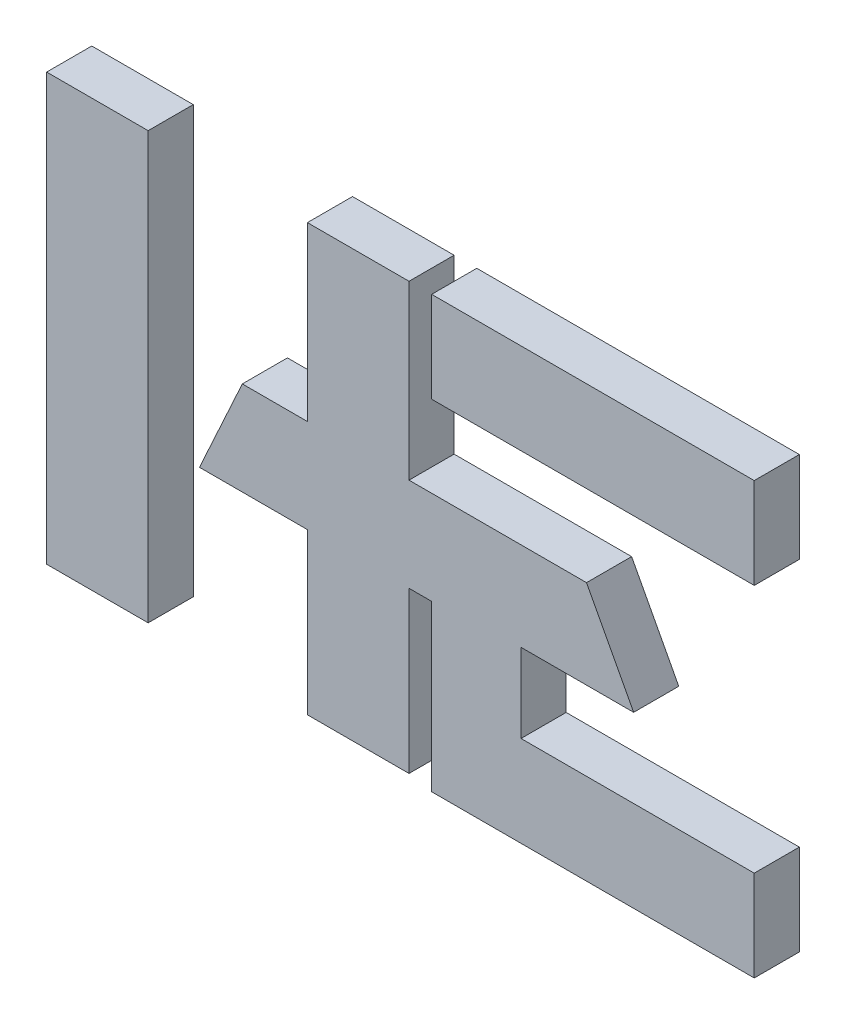
from build123d import *

# Parameters (mm, degrees)
BOSS_EXTRUDE1_DEPTH   = 2
SKETCH1_W             = 2.5
SKETCH1_H             = 10.5
BOSS_EXTRUDE1_2_DEPTH = 2
SKETCH1_W_2           = 7.945592629
SKETCH1_H_2           = 2.237026011
BOSS_EXTRUDE1_3_DEPTH = 2
SCALE2_SCALE          = 1.8
SKETCH2_W             = 50.62339921
SKETCH2_H             = 36.944200243
CUT_EXTRUDE1_DEPTH    = 1.6


with BuildPart() as part:
    # Sketch1 → Boss-Extrude1 (new body)
    with BuildSketch(Plane.XY):
        Polygon((-3.895135439, 1.034757073), (-4.950527249, -1.272027883), (-3.855272926, -1.272027883), (-2.291707931, -1.272027883), (-2.291707931, -5.222208659), (0.211078362, -5.222208659), (0.211078362, -1.272027883), (0.768928319, -1.272027883), (0.768928319, -5.333374023), (8.714520948, -5.333374023), (8.714520948, -3.096348012), (2.970174095, -3.096348012), (2.970174095, -1.151411676), (4.583415862, -1.151411676), (5.744346853, -1.151411676), (4.583415862, 1.034757073), (2.970174095, 1.034757073), (0.768928319, 1.034757073), (0.211078362, 1.034757073), (0.211078362, 5.277791341), (-2.291707931, 5.277791341), (-2.291707931, 1.034757073), align=None)
    extrude(amount=BOSS_EXTRUDE1_DEPTH)


with BuildPart() as body_2:
    # Sketch1 → Boss-Extrude1 2 (new body)
    with BuildSketch(Plane.XY):
        with Locations((-7.464520948, 0.027791341)):
            Rectangle(SKETCH1_W, SKETCH1_H)
    extrude(amount=BOSS_EXTRUDE1_2_DEPTH)


with BuildPart() as body_3:
    # Sketch1 → Boss-Extrude1 3 (new body)
    with BuildSketch(Plane.XY):
        with Locations((4.741724634, 4.159278335)):
            Rectangle(SKETCH1_W_2, SKETCH1_H_2)
    extrude(amount=BOSS_EXTRUDE1_3_DEPTH)


with BuildPart() as body_2_1:
    # Scale2: scaled about (0, 0, 0)
    add(body_2.part.scale(SCALE2_SCALE))


with BuildPart() as part_1:
    # Scale2: scaled about (0, 0, 0)
    add(part.part.scale(SCALE2_SCALE))


with BuildPart() as body_3_1:
    # Scale2: scaled about (0, 0, 0)
    add(body_3.part.scale(SCALE2_SCALE))


with BuildPart() as cut_extrude1_tool:
    # Sketch2 → Cut-Extrude1 (new body)
    with BuildSketch(Plane.XY.offset(3.6)):
        with Locations((1.515592459, -1.731428702)):
            Rectangle(SKETCH2_W, SKETCH2_H)
    extrude(amount=-CUT_EXTRUDE1_DEPTH)


with BuildPart() as part_2:
    add(part_1.part)

    # Cut-Extrude1: cut by cut_extrude1_tool
    add(cut_extrude1_tool.part, mode=Mode.SUBTRACT)


with BuildPart() as body_2_2:
    add(body_2_1.part)

    # Cut-Extrude1: cut by cut_extrude1_tool
    add(cut_extrude1_tool.part, mode=Mode.SUBTRACT)


with BuildPart() as body_3_2:
    add(body_3_1.part)

    # Cut-Extrude1: cut by cut_extrude1_tool
    add(cut_extrude1_tool.part, mode=Mode.SUBTRACT)


solid = Compound([part_2.part, body_2_2.part, body_3_2.part])
